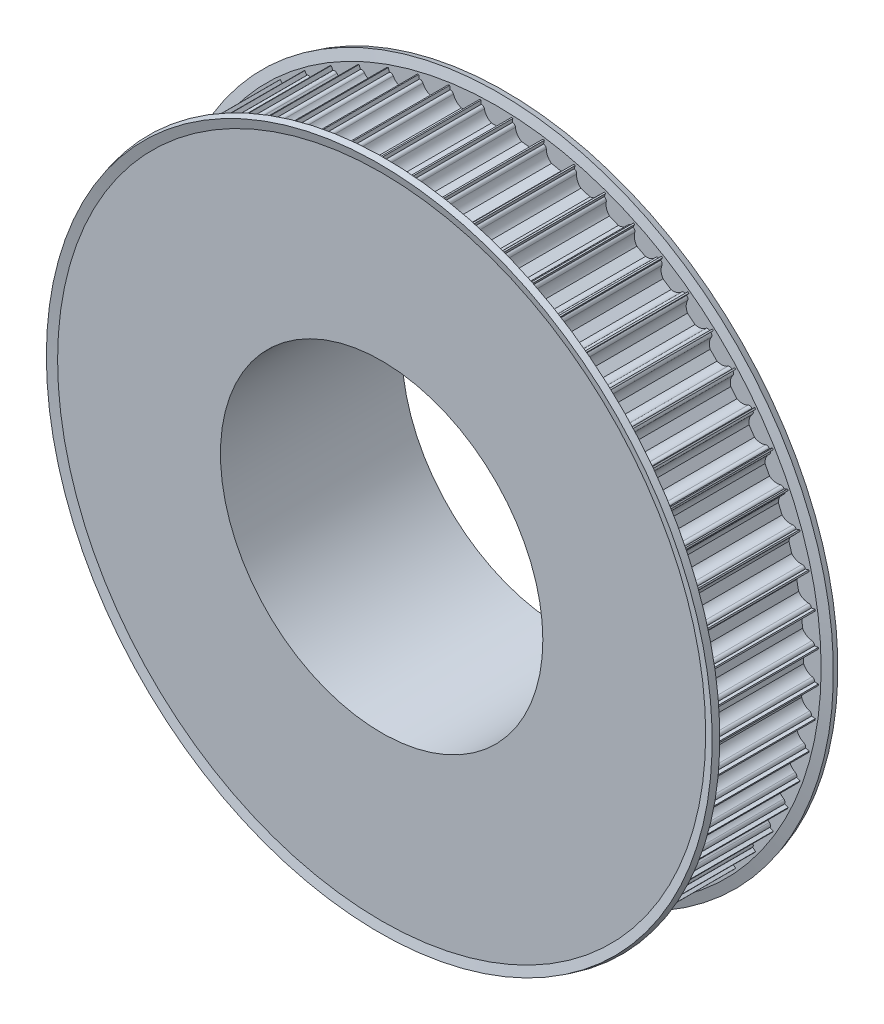
from build123d import *

# Parameters (mm, degrees)
CUT_EXTRUDE1_REACH = 123.758
CIRPATTERN1_COUNT  = 64


with BuildPart() as part:
    # Sketch1 → Revolve1 (revolve)
    with BuildSketch(Plane(origin=(0, 0, 0), x_dir=(0, 0, -1), z_dir=(1, 0, 0))):
        Polygon((0, 40), (45, 40), (45, 55.5), (30, 55.5), (30, 80), (0, 80), align=None)
    revolve(axis=Axis((0, 0, 0), (0, 0, -1)))

    # Sketch5 → Cut-Extrude1 (cut, up to next)
    with BuildSketch(Plane.XY, mode=Mode.PRIVATE) as cut_extrude1_sk1:
        with BuildLine():
            Line((-3.674234614, 79), (-3.75, 79))
            Line((-3.75, 79), (-3.75, 81))
            Line((-3.75, 81), (3.75, 81))
            Line((3.75, 81), (3.75, 79))
            Line((3.75, 79), (3.674234614, 79))
            ThreePointArc((3.674234614, 79), (3.199892965, 78.830947502), (2.939387691, 78.4))
            ThreePointArc((2.939387691, 78.4), (2.331759211, 77.112435701), (1.198957881, 76.25))
            Line((1.198957881, 76.25), (-1.198957881, 76.25))
            ThreePointArc((-1.198957881, 76.25), (-2.331759211, 77.112435701), (-2.939387691, 78.4))
            ThreePointArc((-2.939387691, 78.4), (-3.199892965, 78.830947502), (-3.674234614, 79))
        make_face()
    cut_extrude1_tool1 = extrude(cut_extrude1_sk1.sketch, amount=-CUT_EXTRUDE1_REACH, mode=Mode.PRIVATE) & part.part
    cut_extrude1 = cut_extrude1_tool1.solids().sort_by_distance((0, 78.935169, 0))[0]
    add(cut_extrude1, mode=Mode.SUBTRACT)

    # CirPattern1: Cut-Extrude1 ×64 about axis
    cirpattern1_axis = Axis((0, 0, 0), (0, 0, 1))
    for i in range(1, CIRPATTERN1_COUNT):
        add(cut_extrude1.rotate(cirpattern1_axis, i * 360 / CIRPATTERN1_COUNT), mode=Mode.SUBTRACT)

    # Sketch6 → Revolve2 (revolve)
    with BuildSketch(Plane(origin=(0, 0, 0), x_dir=(0, 0, -1), z_dir=(1, 0, 0))):
        Polygon((30, 55.5), (30, 80.405554958), (30.590163791, 82.608076211), (29.090163791, 83.01), (28.447085729, 80.61), (28.447085729, 55.5), align=None)
        Polygon((1.552914271, 55.5), (0, 55.5), (0, 80.405554958), (-0.590163791, 82.608076211), (0.909836209, 83.01), (1.552914271, 80.61), align=None)
    revolve(axis=Axis((0, 0, 0), (0, 0, 1)))


solid = part.part
